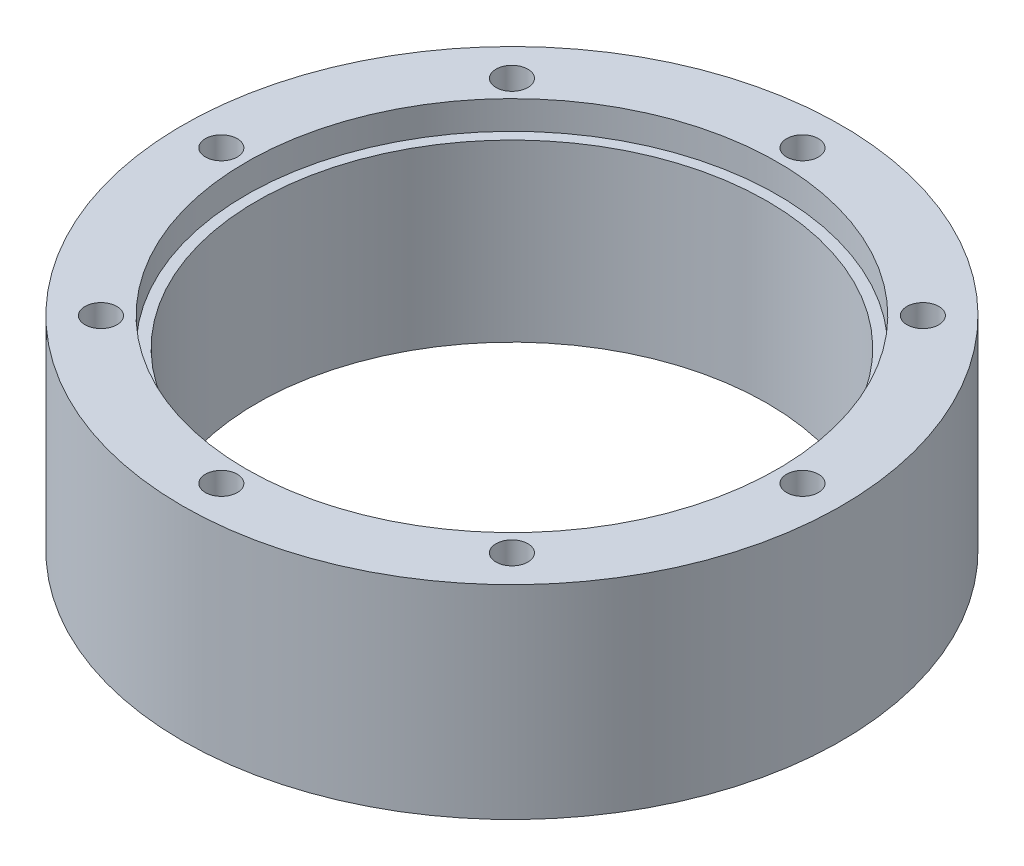
from build123d import *

# Parameters (mm, degrees)
SKETCH1_R           = 46.5
SKETCH1_R_2         = 36
BOSS_EXTRUDE1_DEPTH = 28.7
SKETCH2_R           = 2.25
CUT_EXTRUDE1_DEPTH  = 72.750888496
CUT_EXTRUDE2_START  = -4
SKETCH3_R           = 37.5
SKETCH3_R_2         = 36
CUT_EXTRUDE2_DEPTH  = 4


with BuildPart() as part:
    # Sketch1 → Boss-Extrude1 (new body)
    with BuildSketch(Plane(origin=(0, 0, 0), x_dir=(1, 0, 0), z_dir=(0, 1, 0))):
        Circle(SKETCH1_R)
        Circle(SKETCH1_R_2, mode=Mode.SUBTRACT)
    extrude(amount=BOSS_EXTRUDE1_DEPTH)

    # Sketch2 → Cut-Extrude1 (cut, through all)
    with BuildSketch(Plane(origin=(0, 28.7, 0), x_dir=(1, 0, 0), z_dir=(0, 1, 0))):
        with Locations((0, 41)):
            Circle(SKETCH2_R)
        with Locations((28.991378029, 28.991378029)):
            Circle(SKETCH2_R)
        with Locations((41, 0)):
            Circle(SKETCH2_R)
        with Locations((28.991378029, -28.991378029)):
            Circle(SKETCH2_R)
        with Locations((0, -41)):
            Circle(SKETCH2_R)
        with Locations((-28.991378029, -28.991378029)):
            Circle(SKETCH2_R)
        with Locations((-41, 0)):
            Circle(SKETCH2_R)
        with Locations((-28.991378029, 28.991378029)):
            Circle(SKETCH2_R)
    extrude(amount=-CUT_EXTRUDE1_DEPTH, mode=Mode.SUBTRACT)

    # Sketch3 → Cut-Extrude2 (cut)
    with BuildSketch(Plane(origin=(0, 28.7, 0), x_dir=(1, 0, 0), z_dir=(0, 1, 0)).offset(CUT_EXTRUDE2_START)):
        Circle(SKETCH3_R)
        Circle(SKETCH3_R_2, mode=Mode.SUBTRACT)
    extrude(amount=CUT_EXTRUDE2_DEPTH, mode=Mode.SUBTRACT)


solid = part.part
